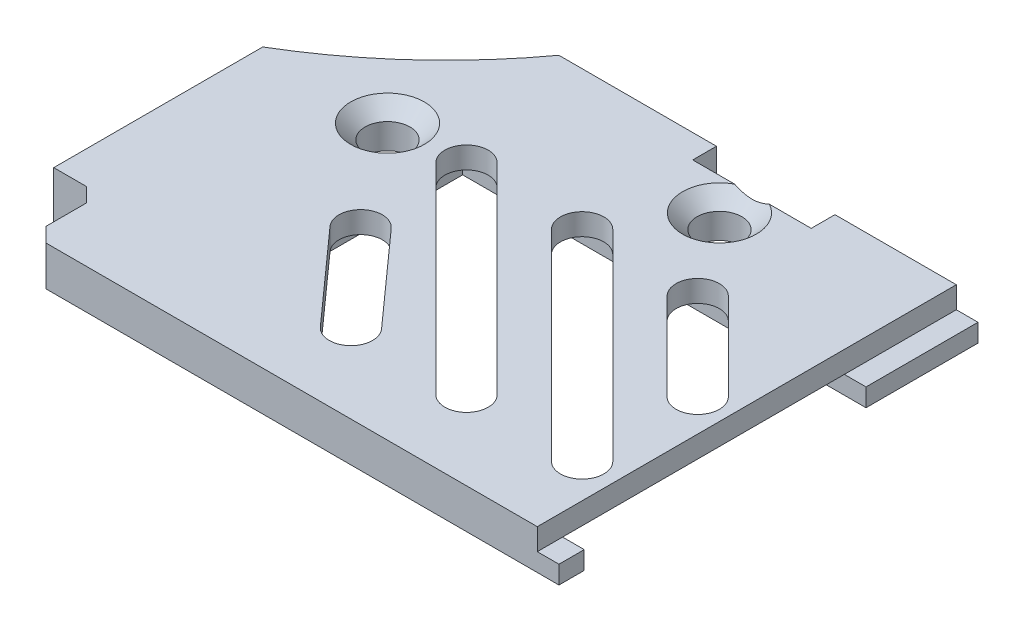
from build123d import *

# Parameters (mm, degrees)
SKETCH_221_R           = 1.55
EXTRUDE_926_DEPTH      = 2.75
SKETCH_1005_W          = 35.000000002
SKETCH_1005_H          = 4.75
EXTRUDE_1111_DEPTH     = 2.75
EXTRUDE_1_DEPTH        = 2.75
F_2_PCB_START          = -4
F_2_PCB_DEPTH          = 4
SKETCH_2154_W          = 1.5
SKETCH_2154_H          = 28.99988509
EXTRUDE_2226_DEPTH     = 1.25
SKETCH_2278_W          = 27.915979255
SKETCH_2278_H          = 19.5
PCB_DEPTH              = 1.25
CUT_EXTRUDE_2_DEPTH    = 33.528299963
CHAMFER_1_SIZE         = 1
CHAMFER_2_SIZE         = 1
CUT_EXTRUDE_3384_DEPTH = 4


with BuildPart() as part:
    # Sketch 221 → Extrude 926 (new body)
    with BuildSketch(Plane(origin=(0, 0, 0), x_dir=(1, 0, 0), z_dir=(0, 1, 0))):
        with BuildLine():
            ThreePointArc((-16.252981126, 10), (-20.15501929, 5.688743466), (-24.715186194, 2.08073674))
            Line((-24.715186194, 2.08073674), (-24.500000002, 0.312480077))
            Line((-24.500000002, 0.312480077), (-24.500000002, -7.263629174))
            Line((-24.500000002, -7.263629174), (-22.500000002, -7.263629174))
            Line((-22.500000002, -7.263629174), (-22.500000002, -14.24988509))
            Line((-22.500000002, -14.24988509), (12.5, -14.24988509))
            Line((12.5, -14.24988509), (12.5, 10))
            Line((12.5, 10), (4.100927374, 10))
            Line((4.100927374, 10), (4.100927374, 8.35804307))
            Line((4.100927374, 8.35804307), (-4.100927378, 8.35804307))
            Line((-4.100927378, 8.35804307), (-4.100927378, 10))
            Line((-4.100927378, 10), (-16.252981126, 10))
        make_face()
        with Locations(Location((-16.865979255, 0, 0), (0, 0, 270))):
            Circle(SKETCH_221_R, mode=Mode.SUBTRACT)
        with Locations(Location((-2e-09, 6.108043073, 0), (0, 0, 270))):
            Circle(SKETCH_221_R, mode=Mode.SUBTRACT)
    extrude(amount=EXTRUDE_926_DEPTH)

    # Sketch 1005 → Extrude 1111 (add)
    with BuildSketch(Plane(origin=(0, 0, 0), x_dir=(1, 0, 0), z_dir=(0, 1, 0))):
        with Locations((-5.000000001, -16.62488509)):
            Rectangle(SKETCH_1005_W, SKETCH_1005_H)
    extrude(amount=EXTRUDE_1111_DEPTH)

    # Sketch 1191 → 卡榫结构-1 (add)
    with BuildSketch(Plane(origin=(0, 0, 0), x_dir=(1, 0, 0), z_dir=(0, 1, 0))):
        with BuildLine():
            Line((-25.750000002, -14.213629174), (-22.500000002, -14.213629174))
            Line((-22.500000002, -14.213629174), (-22.500000002, -7.263629174))
            Line((-22.500000002, -7.263629174), (-24.500000002, -7.263629174))
            Line((-24.500000002, -7.263629174), (-24.500000002, 0.312480077))
            Line((-24.500000002, 0.312480077), (-24.715186194, 2.08073674))
            ThreePointArc((-24.715186194, 2.08073674), (-25.291636518, 1.705823535), (-25.875319612, 1.342273079))
            Line((-25.875319612, 1.342273079), (-25.750000002, 0.312480077))
            Line((-25.750000002, 0.312480077), (-25.750000002, -14.213629174))
        make_face()
    extrude(amount=EXTRUDE_1_DEPTH)

    # 草图5<4> → 卡榫结构-2-注意PCB凸出部分 (add)
    with BuildSketch(Plane(origin=(0, 0, 0), x_dir=(1, 0, 0), z_dir=(0, 1, 0)).offset(F_2_PCB_START)):
        with BuildLine():
            Line((-25.750000002, -14.213629174), (-23.500000002, -14.213629174))
            Line((-23.500000002, -14.213629174), (-23.500000002, -7.263629174))
            Line((-23.500000002, -7.263629174), (-24.500000002, -7.263629174))
            Line((-24.500000002, -7.263629174), (-24.500000002, 0.312480077))
            Line((-24.500000002, 0.312480077), (-24.715186194, 2.08073674))
            ThreePointArc((-24.715186194, 2.08073674), (-25.291636518, 1.705823535), (-25.875319612, 1.342273079))
            Line((-25.875319612, 1.342273079), (-25.750000002, 0.312480077))
            Line((-25.750000002, 0.312480077), (-25.750000002, -14.213629174))
        make_face()
    extrude(amount=F_2_PCB_DEPTH)

    # Sketch 2154 → Extrude 2226 (add)
    with BuildSketch(Plane(origin=(0, 0, 0), x_dir=(1, 0, 0), z_dir=(0, 1, 0))):
        with Locations((13.25, -4.499942545)):
            Rectangle(SKETCH_2154_W, SKETCH_2154_H)
    extrude(amount=EXTRUDE_2226_DEPTH)

    # Sketch 2278 → 稳压PCB器件高度补偿 (cut)
    with BuildSketch(Plane(origin=(0, 0, 0), x_dir=(1, 0, 0), z_dir=(0, 1, 0))):
        with Locations((0.042010372, -7.5)):
            Rectangle(SKETCH_2278_W, SKETCH_2278_H)
    extrude(amount=PCB_DEPTH, mode=Mode.SUBTRACT)

    # Sketch 2514 → 切除-拉伸2 (cut, through all)
    with BuildSketch(Plane.XZ.offset(-1.25)):
        with BuildLine():
            Line((3.173198201, 0.69066828), (9.20694903, 6.724419109))
            ThreePointArc((9.20694903, 6.724419109), (11.328269373, 6.724419109), (11.328269373, 4.603098766))
            Line((11.328269373, 4.603098766), (5.294518544, -1.430652063))
            ThreePointArc((5.294518544, -1.430652063), (3.173198201, -1.430652063), (3.173198201, 0.69066828))
        make_face()
        with BuildLine():
            Line((-4.826801799, 0.69066828), (9.08250112, 14.5999712))
            ThreePointArc((9.08250112, 14.5999712), (11.203821464, 14.5999712), (11.203821464, 12.478650856))
            Line((11.203821464, 12.478650856), (-2.705481456, -1.430652063))
            ThreePointArc((-2.705481456, -1.430652063), (-4.826801799, -1.430652063), (-4.826801799, 0.69066828))
        make_face()
        with BuildLine():
            Line((-12.826801799, 0.69066828), (1.08250112, 14.5999712))
            ThreePointArc((1.08250112, 14.5999712), (3.203821464, 14.5999712), (3.203821464, 12.478650856))
            Line((3.203821464, 12.478650856), (-10.705481456, -1.430652063))
            ThreePointArc((-10.705481456, -1.430652063), (-12.826801799, -1.430652063), (-12.826801799, 0.69066828))
        make_face()
        with BuildLine():
            Line((-4.738916917, 12.539185601), (-10.437516852, 6.169395501))
            ThreePointArc((-10.437516852, 6.169395501), (-12.555564069, 6.051599138), (-12.673360433, 8.169646355))
            Line((-12.673360433, 8.169646355), (-6.974760498, 14.539436455))
            ThreePointArc((-6.974760498, 14.539436455), (-4.856713281, 14.657232819), (-4.738916917, 12.539185601))
        make_face()
    extrude(amount=-CUT_EXTRUDE_2_DEPTH, mode=Mode.SUBTRACT)

    # 倒角1
    chamfer_1_edges = [part.edges().sort_by_distance(p)[0] for p in [
        (-20.661675073, 2.75, -5.223818951),
        (-22.500000002, 1.375, 18.99988509),
        (-22.500000002, 1.375, 14.213629174),
    ]]
    chamfer(chamfer_1_edges, length=CHAMFER_1_SIZE)

    # 倒角2
    # the kernel refuses this chamfer: 1 mm, written as the material it takes off along each edge
    with BuildSketch(Plane(origin=(-2e-09, 2.75, -6.108043073), x_dir=(0, 0, 1), z_dir=(-1, 0, 0))) as chamfer_2_piece_1:
        Polygon((1.55 + CHAMFER_2_SIZE, 0), (1.55, -CHAMFER_2_SIZE), (1.55, 0), align=None)
    revolve(axis=Axis((-2e-09, 2.75, -6.108043073), (0, 1, 0)), mode=Mode.SUBTRACT)
    with BuildSketch(Plane(origin=(-16.865979255, 2.75, 0), x_dir=(0, 0, 1), z_dir=(-1, 0, 0))) as chamfer_2_piece_2:
        Polygon((1.55 + CHAMFER_2_SIZE, 0), (1.55, -CHAMFER_2_SIZE), (1.55, 0), align=None)
    revolve(axis=Axis((-16.865979255, 2.75, 0), (0, 1, 0)), mode=Mode.SUBTRACT)

    # 草图1 → Cut-Extrude 3384 (cut)
    with BuildSketch(Plane.XZ.offset(4)):
        with BuildLine():
            Line((-24.715186194, -2.08073674), (-24.500000002, -0.312480077))
            Line((-24.500000002, -0.312480077), (-24.500000002, 7.263629174))
            Line((-24.500000002, 7.263629174), (-23.500000002, 7.263629174))
            Line((-23.500000002, 7.263629174), (-23.500000002, 7.513629174))
            Line((-23.500000002, 7.513629174), (-24.750000002, 7.513629174))
            Line((-24.750000002, 7.513629174), (-24.750000002, -0.312480077))
            Line((-24.750000002, -0.312480077), (-24.946632534, -1.928275128))
            ThreePointArc((-24.946632534, -1.928275128), (-24.830758909, -2.004277534), (-24.715186194, -2.08073674))
        make_face()
    extrude(amount=-CUT_EXTRUDE_3384_DEPTH, mode=Mode.SUBTRACT)


solid = part.part
